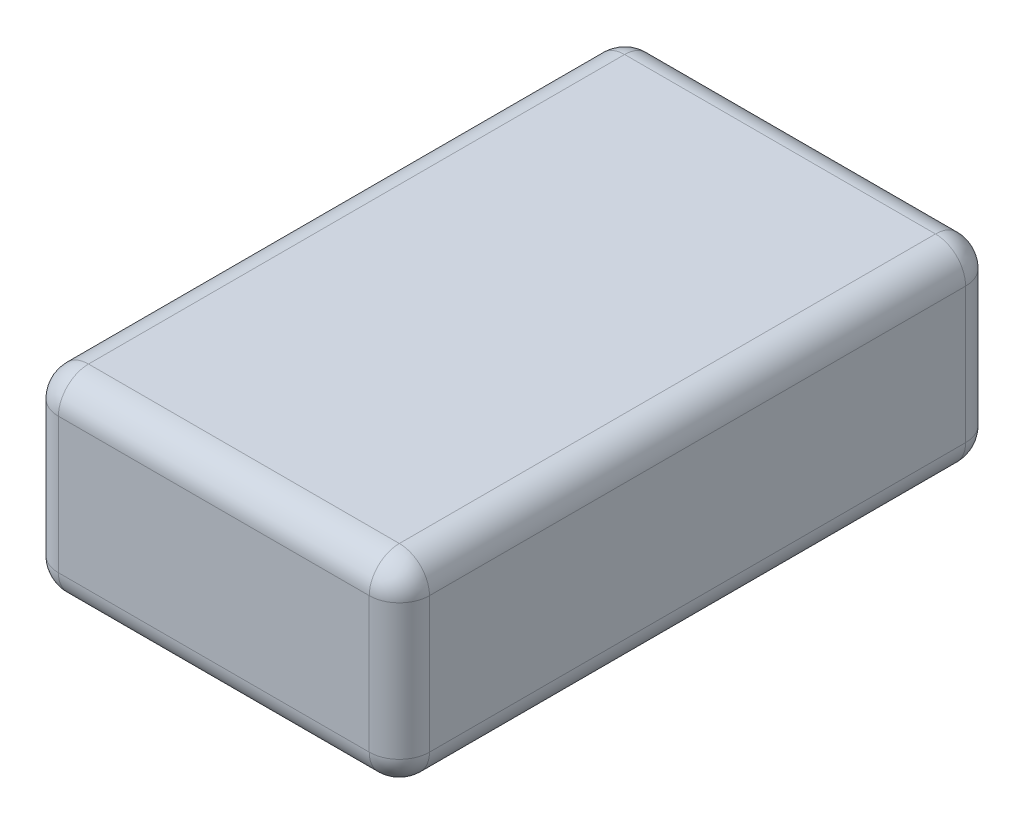
from build123d import *

# Parameters (mm, degrees)
SKETCH1_W           = 123.2
SKETCH1_H           = 65
BOSS_EXTRUDE1_DEPTH = 198
FILLET1_R           = 10
FILLET2_R           = 10
FILLET3_R           = 10


with BuildPart() as part:
    # Sketch1 → Boss-Extrude1 (new body)
    with BuildSketch(Plane.XY):
        with Locations((61.6, 32.5)):
            Rectangle(SKETCH1_W, SKETCH1_H)
    extrude(amount=BOSS_EXTRUDE1_DEPTH)

    # Fillet1
    fillet1_edges = [part.edges().sort_by_distance(p)[0] for p in [
        (61.6, 65, 198),
        (61.6, 65, 0),
        (0, 65, 99),
        (123.2, 65, 99),
    ]]
    fillet(fillet1_edges, radius=FILLET1_R)

    # Fillet2
    fillet2_edges = [part.edges().sort_by_distance(p)[0] for p in [
        (61.6, 0, 198),
        (61.6, 0, 0),
        (0, 0, 99),
        (123.2, 0, 99),
    ]]
    fillet(fillet2_edges, radius=FILLET2_R)

    # Fillet3
    # the kernel refuses this fillet: 10 mm, written as the material it takes off along each edge
    with BuildSketch(Plane(origin=(113.2, 55, 10), x_dir=(0, 0, -1), z_dir=(1, 0, 0))) as fillet3_piece_1_section:
        Polygon((0, 0), (FILLET3_R * 1.02, 0), (FILLET3_R * 1.02, FILLET3_R * 1.02), (0, FILLET3_R * 1.02), align=None)
    fillet3_piece_1 = extrude(amount=FILLET3_R * 1.02, mode=Mode.PRIVATE)
    fillet3_piece_1 = fillet3_piece_1 - Plane(origin=(113.2, 55, 10), x_dir=(0, -0.7071067811865475, 0.7071067811865475), z_dir=(1, 0, 0)) * Sphere(FILLET3_R, mode=Mode.PRIVATE)
    add(fillet3_piece_1, mode=Mode.SUBTRACT)
    with BuildSketch(Plane(origin=(113.2, 55, 188), x_dir=(0, 0, 1), z_dir=(1, 0, 0))) as fillet3_piece_2_section:
        Polygon((0, 0), (FILLET3_R * 1.02, 0), (FILLET3_R * 1.02, -FILLET3_R * 1.02), (0, -FILLET3_R * 1.02), align=None)
    fillet3_piece_2 = extrude(amount=FILLET3_R * 1.02, mode=Mode.PRIVATE)
    fillet3_piece_2 = fillet3_piece_2 - Plane(origin=(113.2, 55, 188), x_dir=(0, -0.7071067811865475, -0.7071067811865475), z_dir=(1, 0, 0)) * Sphere(FILLET3_R, mode=Mode.PRIVATE)
    add(fillet3_piece_2, mode=Mode.SUBTRACT)
    with BuildSketch(Plane(origin=(10, 55, 188), x_dir=(-1, 0, 0), z_dir=(0, 0, 1))) as fillet3_piece_3_section:
        Polygon((0, 0), (FILLET3_R * 1.02, 0), (FILLET3_R * 1.02, -FILLET3_R * 1.02), (0, -FILLET3_R * 1.02), align=None)
    fillet3_piece_3 = extrude(amount=FILLET3_R * 1.02, mode=Mode.PRIVATE)
    fillet3_piece_3 = fillet3_piece_3 - Plane(origin=(10, 55, 188), x_dir=(0.7071067811865475, -0.7071067811865475, 0), z_dir=(0, 0, 1)) * Sphere(FILLET3_R, mode=Mode.PRIVATE)
    add(fillet3_piece_3, mode=Mode.SUBTRACT)
    with BuildSketch(Plane(origin=(10, 55, 10), x_dir=(-1, 0, 0), z_dir=(0, 0, -1))) as fillet3_piece_4_section:
        Polygon((0, 0), (FILLET3_R * 1.02, 0), (FILLET3_R * 1.02, FILLET3_R * 1.02), (0, FILLET3_R * 1.02), align=None)
    fillet3_piece_4 = extrude(amount=FILLET3_R * 1.02, mode=Mode.PRIVATE)
    fillet3_piece_4 = fillet3_piece_4 - Plane(origin=(10, 55, 10), x_dir=(0.7071067811865475, -0.7071067811865475, 0), z_dir=(0, 0, -1)) * Sphere(FILLET3_R, mode=Mode.PRIVATE)
    add(fillet3_piece_4, mode=Mode.SUBTRACT)
    with BuildSketch(Plane(origin=(10, 10, 10), x_dir=(-1, 0, 0), z_dir=(0, 0, -1))) as fillet3_piece_5_section:
        Polygon((0, 0), (FILLET3_R * 1.02, 0), (FILLET3_R * 1.02, -FILLET3_R * 1.02), (0, -FILLET3_R * 1.02), align=None)
    fillet3_piece_5 = extrude(amount=FILLET3_R * 1.02, mode=Mode.PRIVATE)
    fillet3_piece_5 = fillet3_piece_5 - Plane(origin=(10, 10, 10), x_dir=(0.7071067811865475, 0.7071067811865475, 0), z_dir=(0, 0, -1)) * Sphere(FILLET3_R, mode=Mode.PRIVATE)
    add(fillet3_piece_5, mode=Mode.SUBTRACT)
    with BuildSketch(Plane(origin=(10, 10, 188), x_dir=(-1, 0, 0), z_dir=(0, 0, 1))) as fillet3_piece_6_section:
        Polygon((0, 0), (FILLET3_R * 1.02, 0), (FILLET3_R * 1.02, FILLET3_R * 1.02), (0, FILLET3_R * 1.02), align=None)
    fillet3_piece_6 = extrude(amount=FILLET3_R * 1.02, mode=Mode.PRIVATE)
    fillet3_piece_6 = fillet3_piece_6 - Plane(origin=(10, 10, 188), x_dir=(0.7071067811865475, 0.7071067811865475, 0), z_dir=(0, 0, 1)) * Sphere(FILLET3_R, mode=Mode.PRIVATE)
    add(fillet3_piece_6, mode=Mode.SUBTRACT)
    with BuildSketch(Plane(origin=(113.2, 10, 188), x_dir=(0, 0, 1), z_dir=(1, 0, 0))) as fillet3_piece_7_section:
        Polygon((0, 0), (FILLET3_R * 1.02, 0), (FILLET3_R * 1.02, FILLET3_R * 1.02), (0, FILLET3_R * 1.02), align=None)
    fillet3_piece_7 = extrude(amount=FILLET3_R * 1.02, mode=Mode.PRIVATE)
    fillet3_piece_7 = fillet3_piece_7 - Plane(origin=(113.2, 10, 188), x_dir=(0, 0.7071067811865475, -0.7071067811865475), z_dir=(1, 0, 0)) * Sphere(FILLET3_R, mode=Mode.PRIVATE)
    add(fillet3_piece_7, mode=Mode.SUBTRACT)
    with BuildSketch(Plane(origin=(113.2, 10, 10), x_dir=(0, 0, -1), z_dir=(1, 0, 0))) as fillet3_piece_8_section:
        Polygon((0, 0), (FILLET3_R * 1.02, 0), (FILLET3_R * 1.02, -FILLET3_R * 1.02), (0, -FILLET3_R * 1.02), align=None)
    fillet3_piece_8 = extrude(amount=FILLET3_R * 1.02, mode=Mode.PRIVATE)
    fillet3_piece_8 = fillet3_piece_8 - Plane(origin=(113.2, 10, 10), x_dir=(0, 0.7071067811865475, 0.7071067811865475), z_dir=(1, 0, 0)) * Sphere(FILLET3_R, mode=Mode.PRIVATE)
    add(fillet3_piece_8, mode=Mode.SUBTRACT)
    with BuildSketch(Plane(origin=(0, 55, 0), x_dir=(1, 0, 0), z_dir=(0, -1, 0)), Plane(origin=(123.2, 10, 198), x_dir=(0, 0, -1), z_dir=(0, 1, 0))) as fillet3_piece_9:
        with BuildLine():
            CenterArc((FILLET3_R, FILLET3_R), FILLET3_R, 180, 90)
            Line((0, FILLET3_R), (0, 0))
            Line((0, 0), (FILLET3_R, 0))
        make_face()
    extrude(amount=45, mode=Mode.SUBTRACT)
    with BuildSketch(Plane(origin=(123.2, 10, 0), x_dir=(0, 0, 1), z_dir=(0, 1, 0)), Plane(origin=(0, 55, 198), x_dir=(1, 0, 0), z_dir=(0, -1, 0))) as fillet3_piece_10:
        with BuildLine():
            CenterArc((FILLET3_R, -FILLET3_R), FILLET3_R, 90, 90)
            Line((0, -FILLET3_R), (0, 0))
            Line((0, 0), (FILLET3_R, 0))
        make_face()
    extrude(amount=45, mode=Mode.SUBTRACT)


solid = part.part
